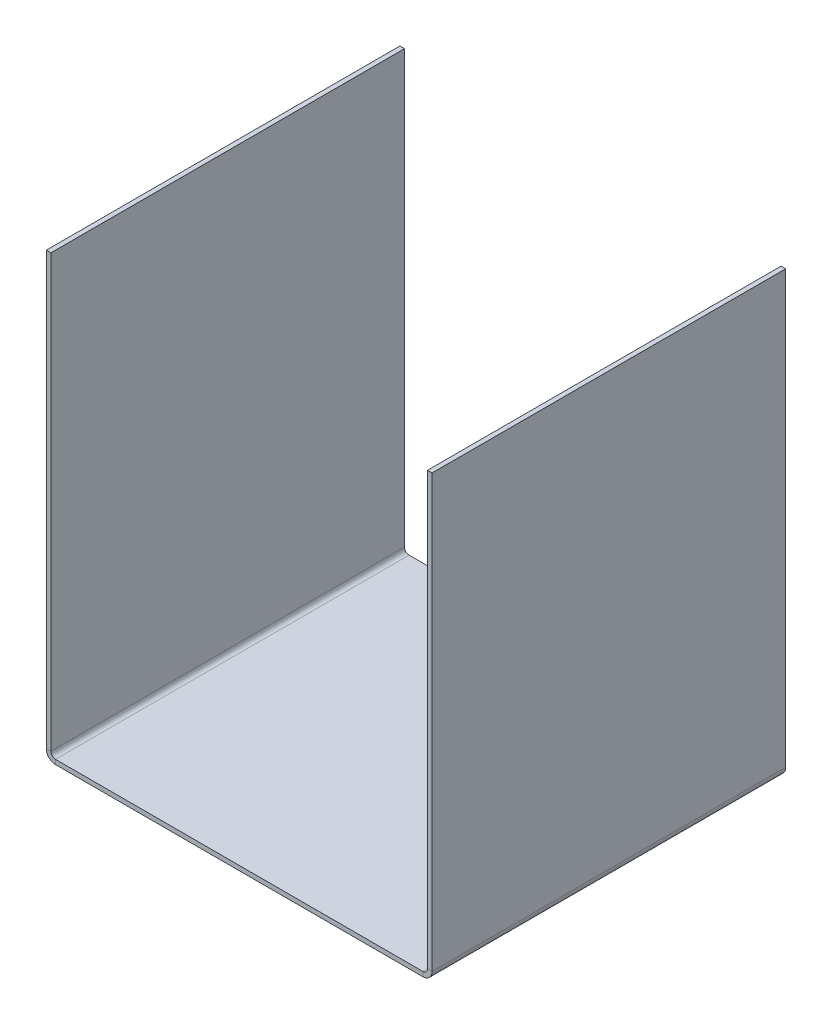
from build123d import *

# Parameters (mm, degrees)
SKETCH_1_W            = 420
SKETCH_1_H            = 480
EXTRUDE_1_DEPTH       = 5
FILLET_1_R            = 5
EXTRUDE_START         = 385
EXTRUDE_3_DEPTH       = 385
CUT_EXTRUDE_START     = -5
CUT_EXTRUDE_2_DEPTH   = 5
SHEET_START           = 5
SHEET_METAL_1_DEPTH   = 385
SHEET_METAL_1_2_DEPTH = 385


# Read off the part's stored shape, not the designer's step: 转换实体1
with BuildPart() as part:
    # Sketch 1 → 凸台-拉伸1 (new body)
    with BuildSketch(Plane.XY):
        Rectangle(SKETCH_1_W, SKETCH_1_H)
    extrude(amount=EXTRUDE_1_DEPTH)

    # 圆角1
    fillet_1_edges = [part.edges().sort_by_distance(p)[0] for p in [
        (210, -240, 2.5),
        (-210, -240, 2.5),
    ]]
    fillet(fillet_1_edges, radius=FILLET_1_R)

    # 草图4 → 凸台-拉伸3 (add)
    with BuildSketch(Plane.XY.offset(5).offset(EXTRUDE_START)):
        with BuildLine():
            Line((-205, 240), (-205, -235))
            Line((-205, -235), (205, -235))
            Line((205, -235), (205, 240))
            Line((205, 240), (210, 240))
            Line((210, 240), (210, -235))
            ThreePointArc((210, -235), (208.535533906, -238.535533906), (205, -240))
            Line((205, -240), (-205, -240))
            ThreePointArc((-205, -240), (-208.535533906, -238.535533906), (-210, -235))
            Line((-210, -235), (-210, 240))
            Line((-210, 240), (-205, 240))
        make_face()
    extrude(amount=-EXTRUDE_3_DEPTH)

    # 草图5 → 切除-拉伸2 (cut)
    with BuildSketch(Plane(origin=(0, 0, 0), x_dir=(-1, 0, 0), z_dir=(0, 0, -1)).offset(CUT_EXTRUDE_START)):
        with BuildLine():
            Line((-205, -240), (205, -240))
            ThreePointArc((205, -240), (208.535533906, -238.535533906), (210, -235))
            Line((210, -235), (210, 240))
            Line((210, 240), (-210, 240))
            Line((-210, 240), (-210, -235))
            ThreePointArc((-210, -235), (-208.535533906, -238.535533906), (-205, -240))
        make_face()
    extrude(amount=CUT_EXTRUDE_2_DEPTH, mode=Mode.SUBTRACT)

    # Sheet Metal 1 outline → Sheet Metal 1 (cut)
    with BuildSketch(Plane.XY.offset(SHEET_START)):
        with BuildLine():
            Line((-205, -240), (-200, -240))
            ThreePointArc((-200, -240), (-207.071067812, -237.071067812), (-210, -230))
            Line((-210, -230), (-210, -235))
            ThreePointArc((-210, -235), (-208.535533906, -238.535533906), (-205, -240))
        make_face()
        with BuildLine():
            ThreePointArc((210, -230), (207.071067812, -237.071067812), (200, -240))
            Line((200, -240), (205, -240))
            ThreePointArc((205, -240), (208.535533906, -238.535533906), (210, -235))
            Line((210, -235), (210, -230))
        make_face()
    extrude(amount=SHEET_METAL_1_DEPTH, mode=Mode.SUBTRACT)

    # Sheet Metal 1 2 outline → Sheet Metal 1 2 (add)
    with BuildSketch(Plane.XY.offset(SHEET_START)):
        with BuildLine():
            Line((-205, -235), (-200, -235))
            ThreePointArc((-200, -235), (-203.535533906, -233.535533906), (-205, -230))
            Line((-205, -230), (-205, -235))
        make_face()
        with BuildLine():
            ThreePointArc((205, -230), (203.535533906, -233.535533906), (200, -235))
            Line((200, -235), (205, -235))
            Line((205, -235), (205, -230))
        make_face()
    extrude(amount=SHEET_METAL_1_2_DEPTH)


solid = part.part
